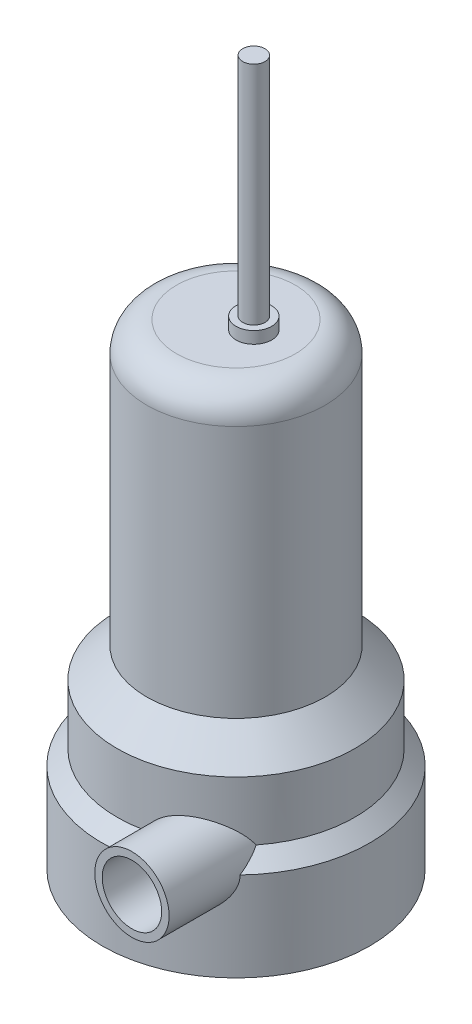
from build123d import *

# Parameters (mm, degrees)
CHAMFER1_SIZE       = 6.35
CHAMFER2_SIZE       = 12.7
SKETCH2_R           = 4.7625
BOSS_EXTRUDE1_DEPTH = 101.6
SKETCH3_R           = 15.875
SKETCH3_R_2         = 12.7
BOSS_EXTRUDE2_DEPTH = 69.85
CUT_EXTRUDE1_START  = -69.85
SKETCH4_R           = 12.7
CUT_EXTRUDE1_DEPTH  = 69.85
SKETCH5_R           = 7.62
BOSS_EXTRUDE3_DEPTH = 5.08


with BuildPart() as part:
    # Sketch1 → Revolve1 (revolve)
    with BuildSketch(Plane.XY):
        with BuildLine():
            Line((0, 0), (-57.15, 0))
            Line((-57.15, 0), (-57.15, 38.1))
            Line((-57.15, 38.1), (-50.8, 38.1))
            Line((-50.8, 38.1), (-50.8, 69.85))
            Line((-50.8, 69.85), (-38.1, 69.85))
            Line((-38.1, 69.85), (-38.1, 190.5))
            ThreePointArc((-38.1, 190.5), (-34.380256121, 199.480256121), (-25.4, 203.2))
            Line((-25.4, 203.2), (0, 203.2))
            Line((0, 203.2), (0, 0))
        make_face()
    revolve(axis=Axis((0, 203.2, 0), (0, -1, 0)))

    # Chamfer1
    chamfer1_edges = [part.edges().sort_by_distance(p)[0] for p in [
        (50.8, 38.1, 0),
    ]]
    chamfer(chamfer1_edges, length=CHAMFER1_SIZE - 0.0001)  # a hair under: the kernel refuses the full size

    # Chamfer2
    chamfer2_edges = [part.edges().sort_by_distance(p)[0] for p in [
        (38.1, 69.85, 0),
    ]]
    chamfer(chamfer2_edges, length=CHAMFER2_SIZE - 0.0001)  # a hair under: the kernel refuses the full size

    # Sketch3 → Boss-Extrude2 (add)
    with BuildSketch(Plane.XY):
        with Locations(Location((25.4, 38.1, 0), (0, 0, 180.00000949))):
            Circle(SKETCH3_R)
        with Locations(Location((25.4, 38.1, 0), (0, 0, 180.000009381))):
            Circle(SKETCH3_R_2, mode=Mode.SUBTRACT)
    extrude(amount=BOSS_EXTRUDE2_DEPTH)

    # Sketch4 → Cut-Extrude1 (cut)
    with BuildSketch(Plane.XY.offset(69.85).offset(CUT_EXTRUDE1_START)):
        with Locations((25.4, 38.1)):
            Circle(SKETCH4_R)
    extrude(amount=CUT_EXTRUDE1_DEPTH, mode=Mode.SUBTRACT)


with BuildPart() as body_2:
    # Sketch2 → Boss-Extrude1 (new body)
    with BuildSketch(Plane(origin=(0, 203.2, 0), x_dir=(1, 0, 0), z_dir=(0, 1, 0))):
        with Locations(Location((7.62, 0, 0), (0, 0, 180))):
            Circle(SKETCH2_R)
    extrude(amount=BOSS_EXTRUDE1_DEPTH)

    # Sketch5 → Boss-Extrude3 (add)
    with BuildSketch(Plane(origin=(0, 203.2, 0), x_dir=(1, 0, 0), z_dir=(0, 1, 0))):
        with Locations(Location((7.62, 0, 0), (0, 0, 180))):
            Circle(SKETCH5_R)
    extrude(amount=BOSS_EXTRUDE3_DEPTH)


solid = Compound([part.part, body_2.part])
